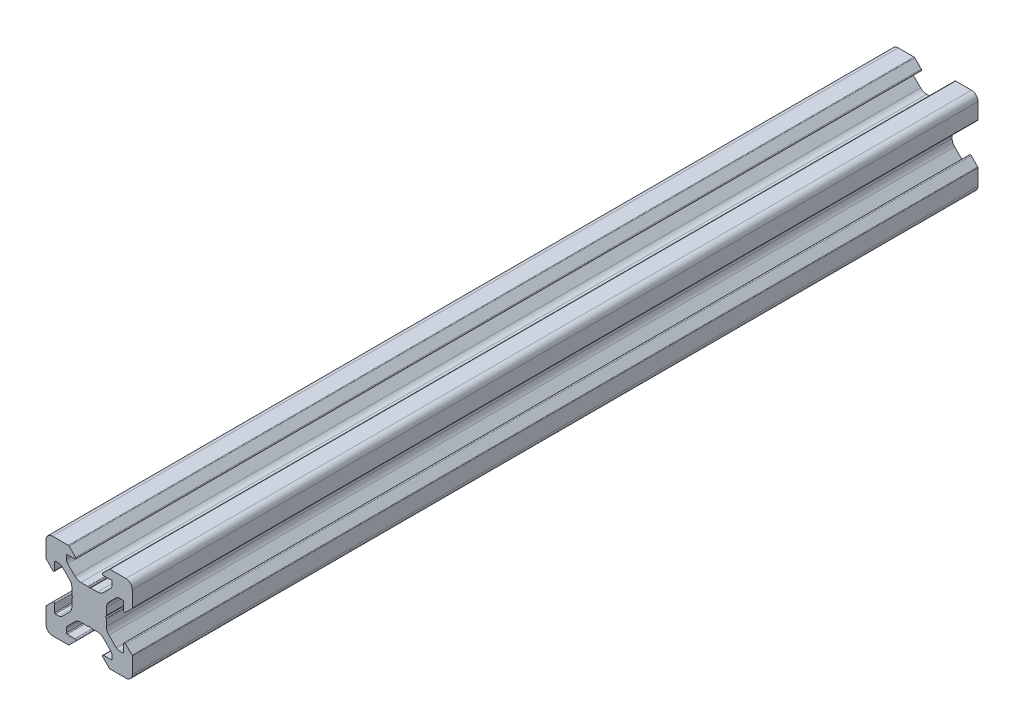
from build123d import *

# Parameters (mm, degrees)
EXTRUDE_1_DEPTH = 196


# Read off the part's stored shape, not the designer's step: 222 Конструкционный профиль 20х20-1-surface1
with BuildPart() as part:
    # Эскиз1 → Бобышка-Вытянуть1 (new body)
    with BuildSketch(Plane.XY):
        with BuildLine():
            Line((-3.945217202, 0.181521503), (-3.8, 0))
            Line((-3.8, 0), (-3.945217202, -0.181521503))
            ThreePointArc((-3.945217202, -0.181521503), (-3.98590708, -0.254943529), (-4, -0.337695265))
            Line((-4, -0.337695265), (-4, -1.898780669))
            ThreePointArc((-4, -1.898780669), (-4.152240935, -2.664147534), (-4.585786438, -3.312994231))
            Line((-4.585786438, -3.312994231), (-6.279898987, -5.007106781))
            ThreePointArc((-6.279898987, -5.007106781), (-6.604322336, -5.223879533), (-6.987005769, -5.3))
            Line((-6.987005769, -5.3), (-7.8, -5.3))
            ThreePointArc((-7.8, -5.3), (-7.941421356, -5.241421356), (-8, -5.1))
            Line((-8, -5.1), (-8, -3.33))
            ThreePointArc((-8, -3.33), (-8.154329142, -3.099030117), (-8.426776695, -3.153223305))
            Line((-8.426776695, -3.153223305), (-9.926776695, -4.653223305))
            ThreePointArc((-9.926776695, -4.653223305), (-9.980969883, -4.734329142), (-10, -4.83))
            Line((-10, -4.83), (-10, -8.5))
            ThreePointArc((-10, -8.5), (-9.560660172, -9.560660172), (-8.5, -10))
            Line((-8.5, -10), (-4.83, -10))
            ThreePointArc((-4.83, -10), (-4.734329142, -9.980969883), (-4.653223305, -9.926776695))
            Line((-4.653223305, -9.926776695), (-3.153223305, -8.426776695))
            ThreePointArc((-3.153223305, -8.426776695), (-3.099030117, -8.154329142), (-3.33, -8))
            Line((-3.33, -8), (-5.1, -8))
            ThreePointArc((-5.1, -8), (-5.241421356, -7.941421356), (-5.3, -7.8))
            Line((-5.3, -7.8), (-5.3, -6.987005769))
            ThreePointArc((-5.3, -6.987005769), (-5.223879533, -6.604322336), (-5.007106781, -6.279898987))
            Line((-5.007106781, -6.279898987), (-3.312994231, -4.585786438))
            ThreePointArc((-3.312994231, -4.585786438), (-2.664147534, -4.152240935), (-1.898780669, -4))
            Line((-1.898780669, -4), (-0.337695265, -4))
            ThreePointArc((-0.337695265, -4), (-0.254943529, -3.98590708), (-0.181521503, -3.945217202))
            Line((-0.181521503, -3.945217202), (0, -3.8))
            Line((0, -3.8), (0.181521503, -3.945217202))
            ThreePointArc((0.181521503, -3.945217202), (0.254943529, -3.98590708), (0.337695265, -4))
            Line((0.337695265, -4), (1.898780669, -4))
            ThreePointArc((1.898780669, -4), (2.664147534, -4.152240935), (3.312994231, -4.585786438))
            Line((3.312994231, -4.585786438), (5.007106781, -6.279898987))
            ThreePointArc((5.007106781, -6.279898987), (5.223879533, -6.604322336), (5.3, -6.987005769))
            Line((5.3, -6.987005769), (5.3, -7.8))
            ThreePointArc((5.3, -7.8), (5.241421356, -7.941421356), (5.1, -8))
            Line((5.1, -8), (3.33, -8))
            ThreePointArc((3.33, -8), (3.099030117, -8.154329142), (3.153223305, -8.426776695))
            Line((3.153223305, -8.426776695), (4.653223305, -9.926776695))
            ThreePointArc((4.653223305, -9.926776695), (4.734329142, -9.980969883), (4.83, -10))
            Line((4.83, -10), (8.5, -10))
            ThreePointArc((8.5, -10), (9.560660172, -9.560660172), (10, -8.5))
            Line((10, -8.5), (10, -4.83))
            ThreePointArc((10, -4.83), (9.980969883, -4.734329142), (9.926776695, -4.653223305))
            Line((9.926776695, -4.653223305), (8.426776695, -3.153223305))
            ThreePointArc((8.426776695, -3.153223305), (8.154329142, -3.099030117), (8, -3.33))
            Line((8, -3.33), (8, -5.1))
            ThreePointArc((8, -5.1), (7.941421356, -5.241421356), (7.8, -5.3))
            Line((7.8, -5.3), (6.987005769, -5.3))
            ThreePointArc((6.987005769, -5.3), (6.604322336, -5.223879533), (6.279898987, -5.007106781))
            Line((6.279898987, -5.007106781), (4.585786438, -3.312994231))
            ThreePointArc((4.585786438, -3.312994231), (4.152240935, -2.664147534), (4, -1.898780669))
            Line((4, -1.898780669), (4, -0.337695265))
            ThreePointArc((4, -0.337695265), (3.98590708, -0.254943529), (3.945217202, -0.181521503))
            Line((3.945217202, -0.181521503), (3.8, 0))
            Line((3.8, 0), (3.945217202, 0.181521503))
            ThreePointArc((3.945217202, 0.181521503), (3.98590708, 0.254943529), (4, 0.337695265))
            Line((4, 0.337695265), (4, 1.898780669))
            ThreePointArc((4, 1.898780669), (4.152240935, 2.664147534), (4.585786438, 3.312994231))
            Line((4.585786438, 3.312994231), (6.279898987, 5.007106781))
            ThreePointArc((6.279898987, 5.007106781), (6.604322336, 5.223879533), (6.987005769, 5.3))
            Line((6.987005769, 5.3), (7.8, 5.3))
            ThreePointArc((7.8, 5.3), (7.941421356, 5.241421356), (8, 5.1))
            Line((8, 5.1), (8, 3.33))
            ThreePointArc((8, 3.33), (8.154329142, 3.099030117), (8.426776695, 3.153223305))
            Line((8.426776695, 3.153223305), (9.926776695, 4.653223305))
            ThreePointArc((9.926776695, 4.653223305), (9.980969883, 4.734329142), (10, 4.83))
            Line((10, 4.83), (10, 8.5))
            ThreePointArc((10, 8.5), (9.560660172, 9.560660172), (8.5, 10))
            Line((8.5, 10), (4.83, 10))
            ThreePointArc((4.83, 10), (4.734329142, 9.980969883), (4.653223305, 9.926776695))
            Line((4.653223305, 9.926776695), (3.153223305, 8.426776695))
            ThreePointArc((3.153223305, 8.426776695), (3.099030117, 8.154329142), (3.33, 8))
            Line((3.33, 8), (5.1, 8))
            ThreePointArc((5.1, 8), (5.241421356, 7.941421356), (5.3, 7.8))
            Line((5.3, 7.8), (5.3, 6.987005769))
            ThreePointArc((5.3, 6.987005769), (5.223879533, 6.604322336), (5.007106781, 6.279898987))
            Line((5.007106781, 6.279898987), (3.312994231, 4.585786438))
            ThreePointArc((3.312994231, 4.585786438), (2.664147534, 4.152240935), (1.898780669, 4))
            Line((1.898780669, 4), (0.337695265, 4))
            ThreePointArc((0.337695265, 4), (0.254943529, 3.98590708), (0.181521503, 3.945217202))
            Line((0.181521503, 3.945217202), (0, 3.8))
            Line((0, 3.8), (-0.181521503, 3.945217202))
            ThreePointArc((-0.181521503, 3.945217202), (-0.254943529, 3.98590708), (-0.337695265, 4))
            Line((-0.337695265, 4), (-1.898780669, 4))
            ThreePointArc((-1.898780669, 4), (-2.664147534, 4.152240935), (-3.312994231, 4.585786438))
            Line((-3.312994231, 4.585786438), (-5.007106781, 6.279898987))
            ThreePointArc((-5.007106781, 6.279898987), (-5.223879533, 6.604322336), (-5.3, 6.987005769))
            Line((-5.3, 6.987005769), (-5.3, 7.8))
            ThreePointArc((-5.3, 7.8), (-5.241421356, 7.941421356), (-5.1, 8))
            Line((-5.1, 8), (-3.33, 8))
            ThreePointArc((-3.33, 8), (-3.099030117, 8.154329142), (-3.153223305, 8.426776695))
            Line((-3.153223305, 8.426776695), (-4.653223305, 9.926776695))
            ThreePointArc((-4.653223305, 9.926776695), (-4.734329142, 9.980969883), (-4.83, 10))
            Line((-4.83, 10), (-8.5, 10))
            ThreePointArc((-8.5, 10), (-9.560660172, 9.560660172), (-10, 8.5))
            Line((-10, 8.5), (-10, 4.83))
            ThreePointArc((-10, 4.83), (-9.980969883, 4.734329142), (-9.926776695, 4.653223305))
            Line((-9.926776695, 4.653223305), (-8.426776695, 3.153223305))
            ThreePointArc((-8.426776695, 3.153223305), (-8.154329142, 3.099030117), (-8, 3.33))
            Line((-8, 3.33), (-8, 5.1))
            ThreePointArc((-8, 5.1), (-7.941421356, 5.241421356), (-7.8, 5.3))
            Line((-7.8, 5.3), (-6.987005769, 5.3))
            ThreePointArc((-6.987005769, 5.3), (-6.604322336, 5.223879533), (-6.279898987, 5.007106781))
            Line((-6.279898987, 5.007106781), (-4.585786438, 3.312994231))
            ThreePointArc((-4.585786438, 3.312994231), (-4.152240935, 2.664147534), (-4, 1.898780669))
            Line((-4, 1.898780669), (-4, 0.337695265))
            ThreePointArc((-4, 0.337695265), (-3.98590708, 0.254943529), (-3.945217202, 0.181521503))
        make_face()
    extrude(amount=EXTRUDE_1_DEPTH)


solid = part.part
